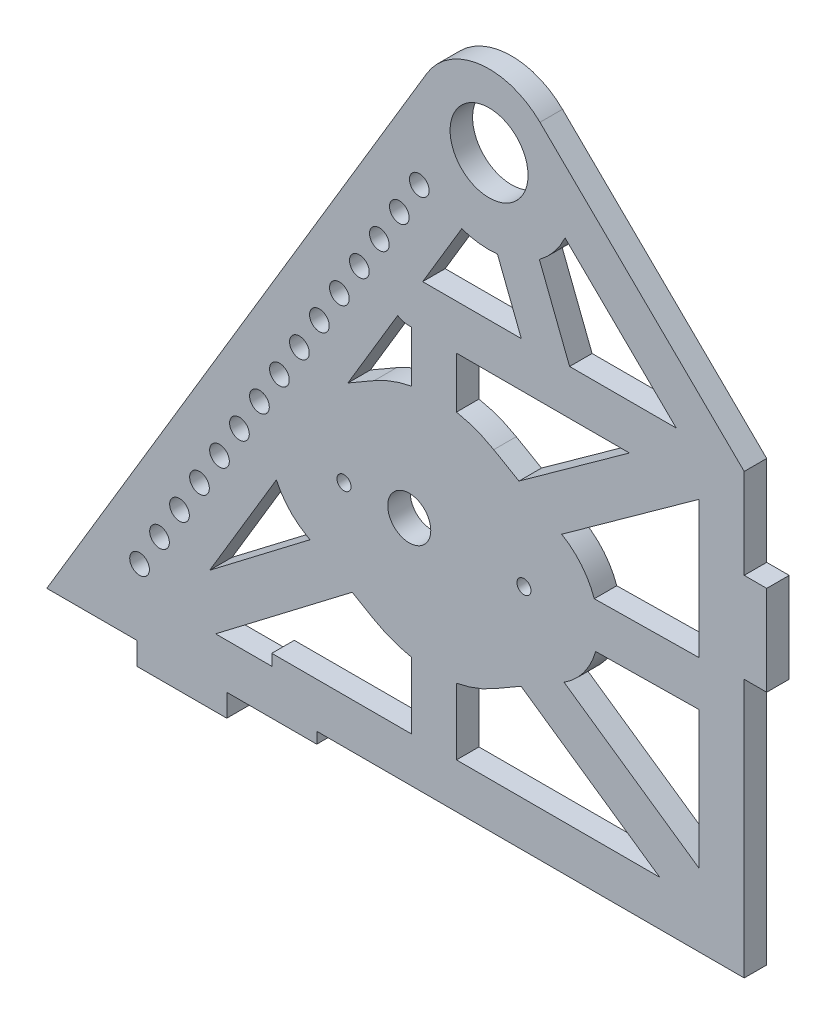
from build123d import *

# Parameters (mm, degrees)
SKETCH2_R               = 11
BOSS_EXTRUDE1_DEPTH     = 6.35
CUT_EXTRUDE2_DEPTH      = 283.224719638
CUT_EXTRUDE2_DEPTH_BACK = 283.224719638
CUT_EXTRUDE3_DEPTH      = 283.224719638
CUT_EXTRUDE3_DEPTH_BACK = 283.224719638
SKETCH6_R               = 1.984375
SKETCH8_R               = 2.778125
CUT_EXTRUDE5_DEPTH      = 283.224719638
CUT_EXTRUDE4_DEPTH      = 50.8


with BuildPart() as part:
    # Sketch2 → Boss-Extrude1 (new body)
    with BuildSketch(Plane.XY):
        with BuildLine():
            Line((50.8, 0), (50.8, 6.35))
            Line((50.8, 6.35), (76.2, 6.35))
            Line((76.2, 6.35), (76.2, 9.525))
            Line((76.2, 9.525), (83.986447759, 9.525))
            Line((83.986447759, 9.525), (196.85, 9.525))
            Line((196.85, 9.525), (196.85, 82.55))
            Line((196.85, 82.55), (203.2, 82.55))
            Line((203.2, 82.55), (203.2, 107.95))
            Line((203.2, 107.95), (196.85, 107.95))
            Line((196.85, 107.95), (196.85, 133.35))
            Line((196.85, 133.35), (139.204596213, 189.884425208))
            ThreePointArc((139.204596213, 189.884425208), (122.208232851, 195.586998388), (107.214428724, 185.75940732))
            Line((107.214428724, 185.75940732), (0, 6.35))
            Line((0, 6.35), (25.4, 6.35))
            Line((25.4, 6.35), (25.4, 0))
            Line((25.4, 0), (50.8, 0))
        make_face()
        with Locations((124.833126, 175.230536)):
            Circle(SKETCH2_R, mode=Mode.SUBTRACT)
    extrude(amount=BOSS_EXTRUDE1_DEPTH)

    # Sketch5 → Cut-Extrude2 (cut, two sides: drawn at the far end of the back side and taken through both)
    with BuildSketch(Plane.XY.offset(6.35).offset(-CUT_EXTRUDE2_DEPTH_BACK)):
        with BuildLine():
            ThreePointArc((107.774174377, 77.336274405), (101.809812982, 68.62981994), (97.344042944, 78.191872762))
            ThreePointArc((97.344042944, 78.191872762), (102.803354213, 80.741537478), (107.774174377, 77.336274405))
        make_face()
    extrude(amount=CUT_EXTRUDE2_DEPTH + CUT_EXTRUDE2_DEPTH_BACK, mode=Mode.SUBTRACT)

    # Sketch6 → Cut-Extrude3 (cut, two sides: drawn at the far end of the back side and taken through both)
    with BuildSketch(Plane(origin=(0, 0, 0), x_dir=(-1, 0, 0), z_dir=(0, 0, -1)).offset(-CUT_EXTRUDE3_DEPTH_BACK)):
        with Locations((-83.883149768, 74.113381171)):
            Circle(SKETCH6_R)
        with Locations((-134.683149768, 74.113381171)):
            Circle(SKETCH6_R)
    extrude(amount=CUT_EXTRUDE3_DEPTH + CUT_EXTRUDE3_DEPTH_BACK, mode=Mode.SUBTRACT)

    # Sketch8 → Cut-Extrude5 (cut, through all)
    with BuildSketch(Plane(origin=(0, 0, 0), x_dir=(-1, 0, 0), z_dir=(0, 0, -1))):
        with Locations((-105.140118089, 157.530916147)):
            Circle(SKETCH8_R)
        with Locations((-99.500048858, 148.092993565)):
            Circle(SKETCH8_R)
        with Locations((-93.859979627, 138.655070983)):
            Circle(SKETCH8_R)
        with Locations((-88.219910396, 129.217148401)):
            Circle(SKETCH8_R)
        with Locations((-82.579841165, 119.77922582)):
            Circle(SKETCH8_R)
        with Locations((-76.939771934, 110.341303238)):
            Circle(SKETCH8_R)
        with Locations((-71.299702703, 100.903380656)):
            Circle(SKETCH8_R)
        with Locations((-65.659633473, 91.465458074)):
            Circle(SKETCH8_R)
        with Locations((-60.019564242, 82.027535492)):
            Circle(SKETCH8_R)
        with Locations((-54.379495011, 72.58961291)):
            Circle(SKETCH8_R)
        with Locations((-48.73942578, 63.151690328)):
            Circle(SKETCH8_R)
        with Locations((-43.099356549, 53.713767746)):
            Circle(SKETCH8_R)
        with Locations((-37.459287318, 44.275845164)):
            Circle(SKETCH8_R)
        with Locations((-31.819218087, 34.837922582)):
            Circle(SKETCH8_R)
        with Locations((-26.179148856, 25.4)):
            Circle(SKETCH8_R)
    extrude(amount=-CUT_EXTRUDE5_DEPTH, mode=Mode.SUBTRACT)

    # Sketch7 → Cut-Extrude4 (cut)
    with BuildSketch(Plane(origin=(0, 0, 0), x_dir=(-1, 0, 0), z_dir=(0, 0, -1))):
        with BuildLine():
            ThreePointArc((-92.405677819, 44.897999253), (-97.505044508, 42.495920228), (-102.933149768, 40.976315821))
            Line((-102.933149768, 40.976315821), (-102.933149768, 22.225))
            Line((-102.933149768, 22.225), (-63.5, 22.225))
            Line((-63.5, 22.225), (-63.5, 19.05))
            Line((-63.5, 19.05), (-47.641846025, 19.05))
            Line((-47.641846025, 19.05), (-86.19055377, 48.488422341))
            Line((-86.19055377, 48.488422341), (-92.405677819, 44.897999253))
        make_face()
        with BuildLine():
            Line((-73.361304065, 55.899768277), (-74.277449866, 55.370518818))
            Line((-74.277449866, 55.370518818), (-45.962310819, 33.747147487))
            Line((-45.962310819, 33.747147487), (-64.79903565, 65.267957495))
            ThreePointArc((-64.79903565, 65.267957495), (-68.35675429, 59.922680867), (-73.361304065, 55.899768277))
        make_face()
        with BuildLine():
            Line((-102.933149768, 121.66695652), (-102.933149768, 107.25044652))
            ThreePointArc((-102.933149768, 107.25044652), (-97.505044508, 105.730842114), (-92.405677819, 103.328763089))
            Line((-92.405677819, 103.328763089), (-84.980763043, 99.039454422))
            Line((-84.980763043, 99.039454422), (-99.040206401, 122.566104988))
            ThreePointArc((-99.040206401, 122.566104988), (-100.608001771, 121.89586972), (-102.297616042, 121.66695652))
            Line((-102.297616042, 121.66695652), (-102.933149768, 121.66695652))
        make_face()
        with BuildLine():
            Line((-115.633149768, 22.225), (-115.633149768, 40.976315821))
            ThreePointArc((-115.633149768, 40.976315821), (-121.061255028, 42.495920228), (-126.160621716, 44.897999253))
            Line((-126.160621716, 44.897999253), (-133.866195799, 49.349442358))
            Line((-133.866195799, 49.349442358), (-173.00254035, 22.225))
            Line((-173.00254035, 22.225), (-115.633149768, 22.225))
        make_face()
        with BuildLine():
            ThreePointArc((-126.160621716, 103.328763089), (-121.061255028, 105.730842114), (-115.633149768, 107.25044652))
            Line((-115.633149768, 107.25044652), (-115.633149768, 121.66695652))
            Line((-115.633149768, 121.66695652), (-164.462773469, 121.66695652))
            Line((-164.462773469, 121.66695652), (-133.280284086, 99.215796082))
            Line((-133.280284086, 99.215796082), (-126.160621716, 103.328763089))
        make_face()
        with BuildLine():
            Line((-184.15, 29.951031396), (-146.006812507, 56.387140909))
            ThreePointArc((-146.006812507, 56.387140909), (-151.563885262, 61.564050478), (-154.920220171, 68.377013582))
            Line((-154.920220171, 68.377013582), (-184.15, 68.770403193))
            Line((-184.15, 68.770403193), (-184.15, 29.951031396))
        make_face()
        with BuildLine():
            Line((-133.935623005, 134.36695652), (-106.092353634, 134.36695652))
            Line((-106.092353634, 134.36695652), (-117.120237583, 152.820686552))
            ThreePointArc((-117.120237583, 152.820686552), (-122.0985457, 151.688826831), (-127.203749259, 151.649396389))
            Line((-127.203749259, 151.649396389), (-133.935623005, 134.36695652))
        make_face()
        with BuildLine():
            ThreePointArc((-154.532818161, 81.072949858), (-150.927365776, 87.476403954), (-145.339192743, 92.248807268))
            Line((-145.339192743, 92.248807268), (-184.15, 120.192299841))
            Line((-184.15, 120.192299841), (-184.15, 81.47097826))
            ThreePointArc((-184.15, 81.47097826), (-184.107272097, 81.470834505), (-184.064546129, 81.470403245))
            Line((-184.064546129, 81.470403245), (-154.532818161, 81.072949858))
        make_face()
        with BuildLine():
            Line((-177.675213837, 134.36695652), (-147.565075979, 134.36695652))
            Line((-147.565075979, 134.36695652), (-139.037679814, 156.258961186))
            ThreePointArc((-139.037679814, 156.258961186), (-143.207115529, 160.261016676), (-146.28395025, 165.153227877))
            Line((-146.28395025, 165.153227877), (-177.675213837, 134.36695652))
        make_face()
    extrude(amount=-CUT_EXTRUDE4_DEPTH, mode=Mode.SUBTRACT)


solid = part.part
